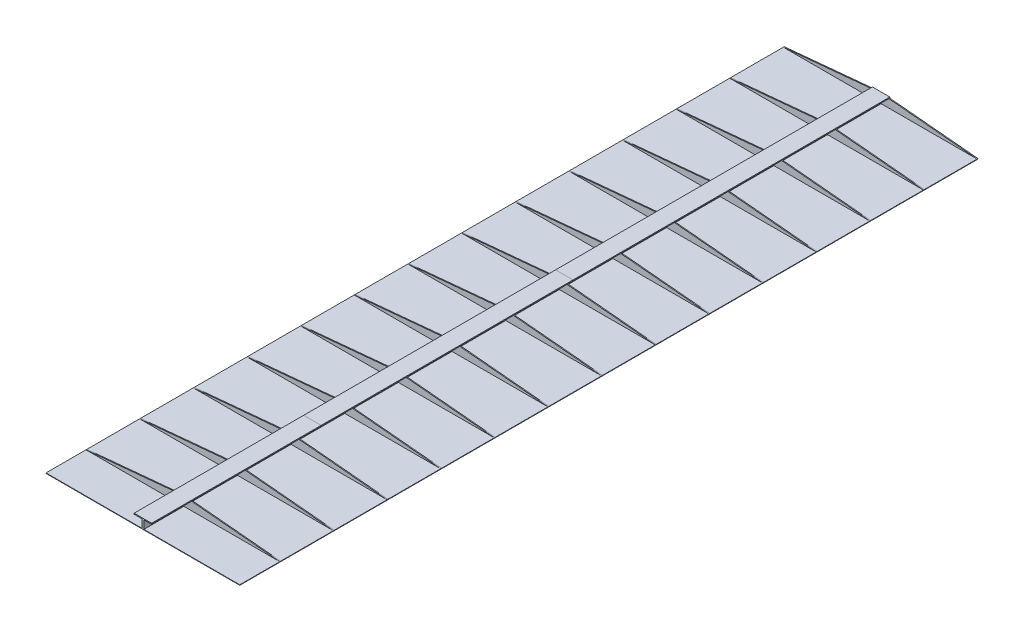
from build123d import *

# Parameters (mm, degrees)
BOSS_EXTRUDE1_DEPTH   = 7620
SKETCH7_W             = 80
SKETCH7_H             = 85
CUT_EXTRUDE3_DEPTH    = 7686.923822157
BOSS_EXTRUDE3_DEPTH   = 9.525
LPATTERN2_COUNT       = 14
LPATTERN2_PITCH       = 553.68
MIRROR2_COPY_1_DEPTH  = 9.525
MIRROR2_COPY_2_DEPTH  = 9.525
MIRROR2_COPY_3_DEPTH  = 9.525
MIRROR2_COPY_4_DEPTH  = 9.525
MIRROR2_COPY_5_DEPTH  = 9.525
MIRROR2_COPY_6_DEPTH  = 9.525
MIRROR2_COPY_7_DEPTH  = 9.525
MIRROR2_COPY_8_DEPTH  = 9.525
MIRROR2_COPY_9_DEPTH  = 9.525
MIRROR2_COPY_10_DEPTH = 9.525
MIRROR2_COPY_11_DEPTH = 9.525
MIRROR2_COPY_12_DEPTH = 9.525
MIRROR2_COPY_13_DEPTH = 9.525
MIRROR2_COPY_14_DEPTH = 9.525


with BuildPart() as part:
    # Sketch1 → Boss-Extrude1 (new body)
    with BuildSketch(Plane.XY):
        Polygon((-90, 95), (90, 95), (90, 0), (1000, 0), (1000, -5), (-1000, -5), (-1000, 0), (-90, 0), align=None)
    extrude(amount=-BOSS_EXTRUDE1_DEPTH)

    # Sketch7 → Cut-Extrude3 (cut, through all)
    with BuildSketch(Plane(origin=(0, 0, -7620), x_dir=(-1, 0, 0), z_dir=(0, 0, -1))):
        with Locations((-50, 42.5)):
            Rectangle(SKETCH7_W, SKETCH7_H)
        with Locations((50, 42.5)):
            Rectangle(SKETCH7_W, SKETCH7_H)
    extrude(amount=-CUT_EXTRUDE3_DEPTH, mode=Mode.SUBTRACT)

    # Sketch8 → Boss-Extrude3 (add)
    with BuildSketch(Plane(origin=(0, 0, -7620), x_dir=(-1, 0, 0), z_dir=(0, 0, -1))):
        Polygon((-10, 0), (-10, 85), (-90, 85), (-1000, 0), align=None)
    boss_extrude3 = extrude(amount=-BOSS_EXTRUDE3_DEPTH)

    # LPattern2: Boss-Extrude3 ×14
    with Locations(*[(0, 0, i * LPATTERN2_PITCH) for i in range(1, LPATTERN2_COUNT)]):
        add(boss_extrude3)

    # Mirror2 copy 1 sketch → Mirror2 copy 1 (add)
    with BuildSketch(Plane(origin=(0, 0, -7066.32), x_dir=(1, 0, 0), z_dir=(0, 0, -1))):
        Polygon((-10, 0), (-10, -85), (-90, -85), (-1000, 0), align=None)
    extrude(amount=-MIRROR2_COPY_1_DEPTH)

    # Mirror2 copy 2 sketch → Mirror2 copy 2 (add)
    with BuildSketch(Plane(origin=(0, 0, -6512.64), x_dir=(1, 0, 0), z_dir=(0, 0, -1))):
        Polygon((-10, 0), (-10, -85), (-90, -85), (-1000, 0), align=None)
    extrude(amount=-MIRROR2_COPY_2_DEPTH)

    # Mirror2 copy 3 sketch → Mirror2 copy 3 (add)
    with BuildSketch(Plane(origin=(0, 0, -5958.96), x_dir=(1, 0, 0), z_dir=(0, 0, -1))):
        Polygon((-10, 0), (-10, -85), (-90, -85), (-1000, 0), align=None)
    extrude(amount=-MIRROR2_COPY_3_DEPTH)

    # Mirror2 copy 4 sketch → Mirror2 copy 4 (add)
    with BuildSketch(Plane(origin=(0, 0, -5405.28), x_dir=(1, 0, 0), z_dir=(0, 0, -1))):
        Polygon((-10, 0), (-10, -85), (-90, -85), (-1000, 0), align=None)
    extrude(amount=-MIRROR2_COPY_4_DEPTH)

    # Mirror2 copy 5 sketch → Mirror2 copy 5 (add)
    with BuildSketch(Plane(origin=(0, 0, -4851.6), x_dir=(1, 0, 0), z_dir=(0, 0, -1))):
        Polygon((-10, 0), (-10, -85), (-90, -85), (-1000, 0), align=None)
    extrude(amount=-MIRROR2_COPY_5_DEPTH)

    # Mirror2 copy 6 sketch → Mirror2 copy 6 (add)
    with BuildSketch(Plane(origin=(0, 0, -4297.92), x_dir=(1, 0, 0), z_dir=(0, 0, -1))):
        Polygon((-10, 0), (-10, -85), (-90, -85), (-1000, 0), align=None)
    extrude(amount=-MIRROR2_COPY_6_DEPTH)

    # Mirror2 copy 7 sketch → Mirror2 copy 7 (add)
    with BuildSketch(Plane(origin=(0, 0, -3744.24), x_dir=(1, 0, 0), z_dir=(0, 0, -1))):
        Polygon((-10, 0), (-10, -85), (-90, -85), (-1000, 0), align=None)
    extrude(amount=-MIRROR2_COPY_7_DEPTH)

    # Mirror2 copy 8 sketch → Mirror2 copy 8 (add)
    with BuildSketch(Plane(origin=(0, 0, -3190.56), x_dir=(1, 0, 0), z_dir=(0, 0, -1))):
        Polygon((-10, 0), (-10, -85), (-90, -85), (-1000, 0), align=None)
    extrude(amount=-MIRROR2_COPY_8_DEPTH)

    # Mirror2 copy 9 sketch → Mirror2 copy 9 (add)
    with BuildSketch(Plane(origin=(0, 0, -2636.88), x_dir=(1, 0, 0), z_dir=(0, 0, -1))):
        Polygon((-10, 0), (-10, -85), (-90, -85), (-1000, 0), align=None)
    extrude(amount=-MIRROR2_COPY_9_DEPTH)

    # Mirror2 copy 10 sketch → Mirror2 copy 10 (add)
    with BuildSketch(Plane(origin=(0, 0, -2083.2), x_dir=(1, 0, 0), z_dir=(0, 0, -1))):
        Polygon((-10, 0), (-10, -85), (-90, -85), (-1000, 0), align=None)
    extrude(amount=-MIRROR2_COPY_10_DEPTH)

    # Mirror2 copy 11 sketch → Mirror2 copy 11 (add)
    with BuildSketch(Plane(origin=(0, 0, -1529.52), x_dir=(1, 0, 0), z_dir=(0, 0, -1))):
        Polygon((-10, 0), (-10, -85), (-90, -85), (-1000, 0), align=None)
    extrude(amount=-MIRROR2_COPY_11_DEPTH)

    # Mirror2 copy 12 sketch → Mirror2 copy 12 (add)
    with BuildSketch(Plane(origin=(0, 0, -975.84), x_dir=(1, 0, 0), z_dir=(0, 0, -1))):
        Polygon((-10, 0), (-10, -85), (-90, -85), (-1000, 0), align=None)
    extrude(amount=-MIRROR2_COPY_12_DEPTH)

    # Mirror2 copy 13 sketch → Mirror2 copy 13 (add)
    with BuildSketch(Plane(origin=(0, 0, -422.16), x_dir=(1, 0, 0), z_dir=(0, 0, -1))):
        Polygon((-10, 0), (-10, -85), (-90, -85), (-1000, 0), align=None)
    extrude(amount=-MIRROR2_COPY_13_DEPTH)

    # Mirror2 copy 14 sketch → Mirror2 copy 14 (add)
    with BuildSketch(Plane(origin=(0, 0, -7620), x_dir=(1, 0, 0), z_dir=(0, 0, -1))):
        Polygon((-10, 0), (-10, -85), (-90, -85), (-1000, 0), align=None)
    extrude(amount=-MIRROR2_COPY_14_DEPTH)


solid = part.part
